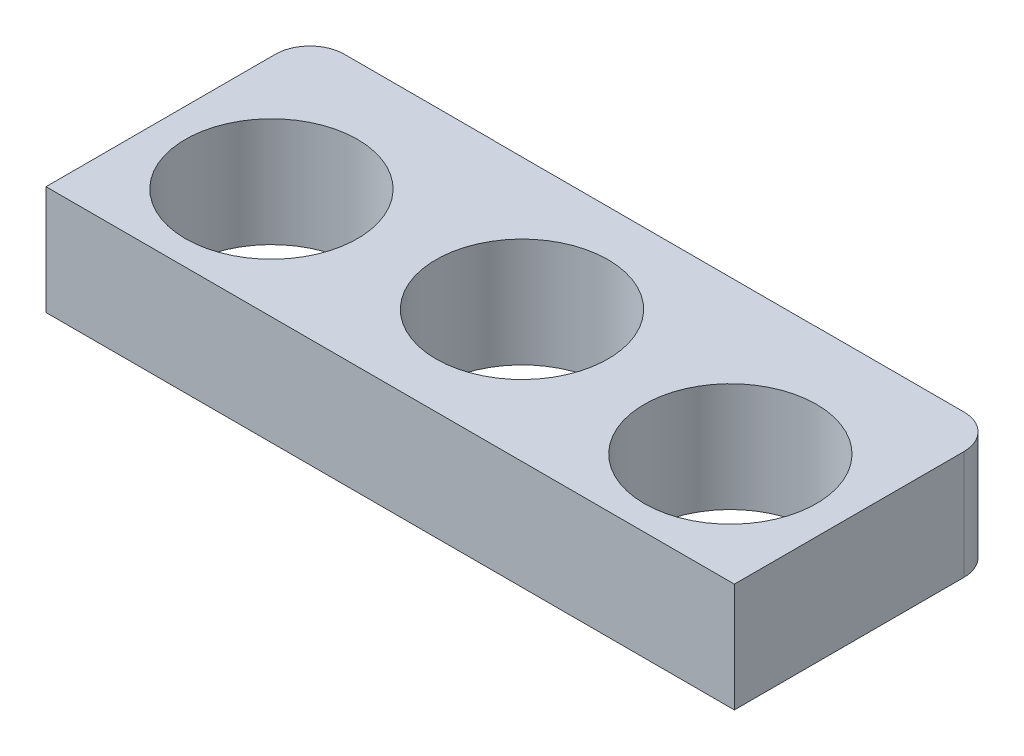
from build123d import *

# Parameters (mm, degrees)
EXTRUDE_1_DEPTH     = 9.5
SKETCH_3_R          = 7.5
CUT_EXTRUDE_2_DEPTH = 39.977557645
FILLET_2_R          = 3


with BuildPart() as part:
    # 草图1 → 凸台-拉伸1 (new body)
    with BuildSketch(Plane(origin=(0, 0, 0), x_dir=(1, 0, 0), z_dir=(0, 1, 0))):
        Polygon((0, 0), (-30, 0), (-30, 23), (-14, 23), (-14, 22.98886809), (14, 22.98886809), (14, 23), (30, 23), (30, 0), align=None)
    extrude(amount=EXTRUDE_1_DEPTH)

    # 草图3 → 切除-拉伸2 (cut, through all)
    with BuildSketch(Plane(origin=(0, 9.5, 0), x_dir=(1, 0, 0), z_dir=(0, 1, 0))):
        with Locations(Location((0, 11.48886809, 0), (0, 0, 270))):
            Circle(SKETCH_3_R)
        with Locations(Location((-20, 9.65, 0), (0, 0, 270))):
            Circle(SKETCH_3_R)
        with Locations(Location((20, 9.65, 0), (0, 0, 270))):
            Circle(SKETCH_3_R)
    extrude(amount=-CUT_EXTRUDE_2_DEPTH, mode=Mode.SUBTRACT)

    # 圆角2
    # the kernel refuses this fillet: 3 mm, written as the material it adds along each edge
    with BuildSketch(Plane(origin=(14, 0, -22.98886809), x_dir=(0, 0, -1), z_dir=(0, 1, 0))) as fillet_2_piece_1:
        with BuildLine():
            CenterArc((3, 0.25820058), FILLET_2_R, 180, 4.937376285)
            Line((0, 0.25820058), (0, 0))
            Line((0, 0), (0.01113191, 0))
        make_face()
    extrude(amount=9.5)
    with BuildSketch(Plane(origin=(-14, 0, -22.98886809), x_dir=(0, 0, -1), z_dir=(0, 1, 0))) as fillet_2_piece_2:
        with BuildLine():
            CenterArc((3, -0.25820058), FILLET_2_R, 175.062623715, 4.937376285)
            Line((0, -0.25820058), (0, 0))
            Line((0, 0), (0.01113191, 0))
        make_face()
    extrude(amount=9.5)
    # the kernel refuses this fillet: 3 mm, written as the material it takes off along each edge
    with BuildSketch(Plane(origin=(30, -7.5, -23), x_dir=(0, 0, 1), z_dir=(0, 1, 0))) as fillet_2_2_piece_1:
        with BuildLine():
            CenterArc((FILLET_2_R, -FILLET_2_R), FILLET_2_R, 90, 90)
            Line((0, -FILLET_2_R), (0, 0))
            Line((0, 0), (FILLET_2_R, 0))
        make_face()
    extrude(amount=24.5, mode=Mode.SUBTRACT)
    with BuildSketch(Plane(origin=(-30, -7.5, -23), x_dir=(0, 0, 1), z_dir=(0, 1, 0))) as fillet_2_2_piece_2:
        with BuildLine():
            CenterArc((FILLET_2_R, FILLET_2_R), FILLET_2_R, 180, 90)
            Line((0, FILLET_2_R), (0, 0))
            Line((0, 0), (FILLET_2_R, 0))
        make_face()
    extrude(amount=24.5, mode=Mode.SUBTRACT)


solid = part.part
